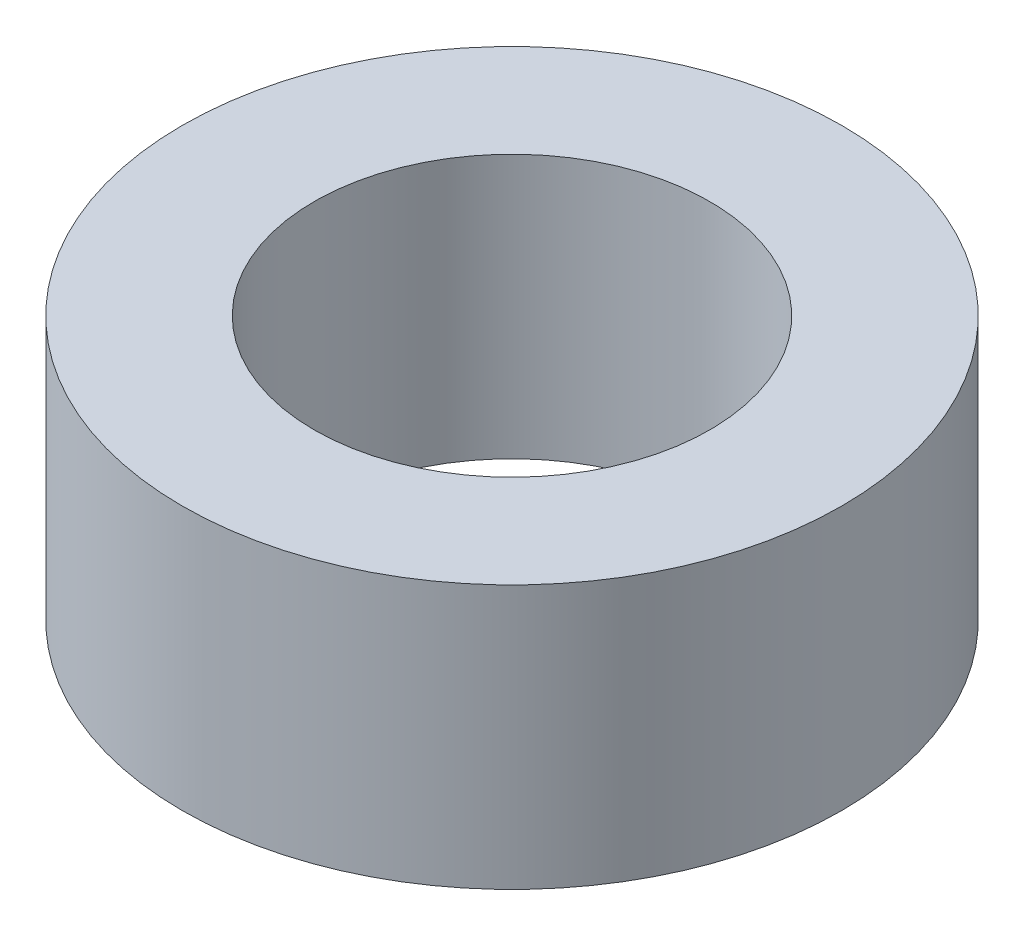
from build123d import *

# Parameters (mm, degrees)
SKETCH1_R           = 25
BOSS_EXTRUDE1_DEPTH = 20
SKETCH2_R           = 15
CUT_EXTRUDE1_DEPTH  = 41.620192023


with BuildPart() as part:
    # Sketch1 → Boss-Extrude1 (new body)
    with BuildSketch(Plane(origin=(0, 0, 0), x_dir=(1, 0, 0), z_dir=(0, 1, 0))):
        Circle(SKETCH1_R)
    extrude(amount=BOSS_EXTRUDE1_DEPTH)

    # Sketch2 → Cut-Extrude1 (cut, through all)
    with BuildSketch(Plane(origin=(0, 0, 0), x_dir=(1, 0, 0), z_dir=(0, 1, 0))):
        Circle(SKETCH2_R)
    extrude(amount=CUT_EXTRUDE1_DEPTH, mode=Mode.SUBTRACT)


solid = part.part
